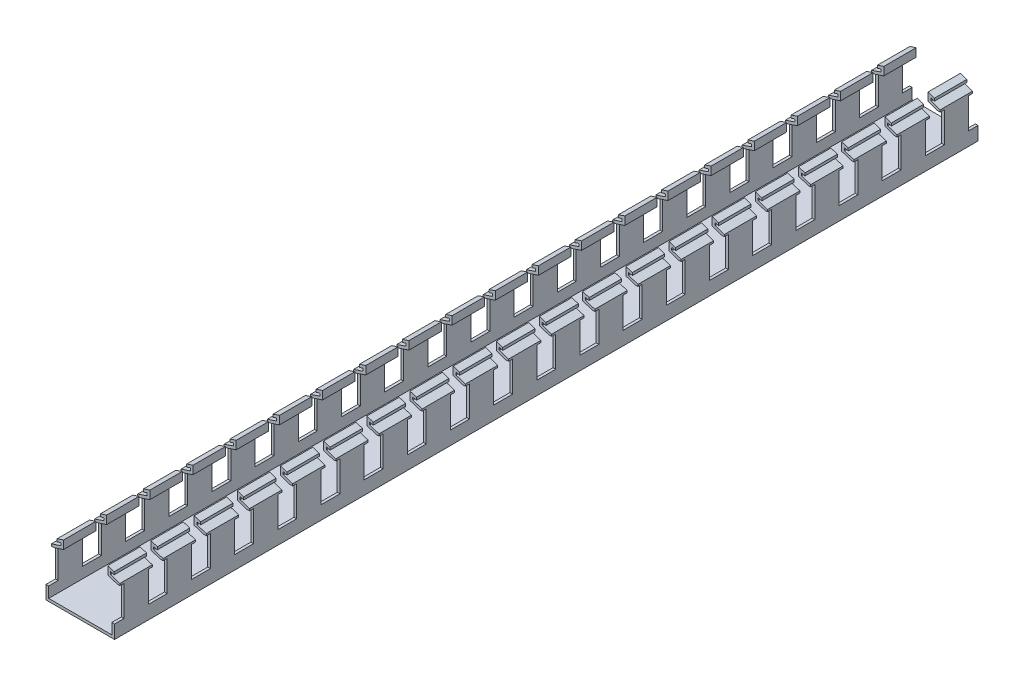
from build123d import *

# Parameters (mm, degrees)
SALIENTE_EXTRUIR1_DEPTH = 8
CORTAR_EXTRUIR1_DEPTH   = 33
MATRIZL1_COUNT          = 20
MATRIZL1_PITCH          = 16


with BuildPart() as part:
    # Croquis2 → Saliente-Extruir1 (new, symmetric)
    with BuildSketch(Plane.XY):
        with BuildLine():
            Line((-12.7, 0), (12.7, 0))
            Line((12.7, 0), (12.7, 17))
            Line((12.7, 17), (9.336754447, 18.121081851))
            ThreePointArc((9.336754447, 18.121081851), (9.237751563, 18.193876454), (9.2, 18.310818511))
            Line((9.2, 18.310818511), (9.2, 18.889181489))
            ThreePointArc((9.2, 18.889181489), (9.283057943, 19.051429926), (9.463245553, 19.078918149))
            Line((9.463245553, 19.078918149), (10.571708245, 18.709430585))
            Line((10.571708245, 18.709430585), (10.571708245, 19.709430585))
            Line((10.571708245, 19.709430585), (8.2, 20.5))
            Line((8.2, 20.5), (8.2, 17.445907447))
            Line((8.2, 17.445907447), (11.7, 16.27924078))
            Line((11.7, 16.27924078), (11.7, 1))
            Line((11.7, 1), (-11.7, 1))
            Line((-11.7, 1), (-11.7, 16.27924078))
            Line((-11.7, 16.27924078), (-8.2, 17.445907447))
            Line((-8.2, 17.445907447), (-8.2, 20.5))
            Line((-8.2, 20.5), (-10.571708245, 19.709430585))
            Line((-10.571708245, 19.709430585), (-10.571708245, 18.709430585))
            Line((-10.571708245, 18.709430585), (-9.463245553, 19.078918149))
            ThreePointArc((-9.463245553, 19.078918149), (-9.283057943, 19.051429926), (-9.2, 18.889181489))
            Line((-9.2, 18.889181489), (-9.2, 18.310818511))
            ThreePointArc((-9.2, 18.310818511), (-9.237751563, 18.193876454), (-9.336754447, 18.121081851))
            Line((-9.336754447, 18.121081851), (-12.7, 17))
            Line((-12.7, 17), (-12.7, 0))
        make_face()
    saliente_extruir1 = extrude(amount=SALIENTE_EXTRUIR1_DEPTH, both=True)

    # Croquis3 → Cortar-Extruir1 (cut, symmetric)
    with BuildSketch(Plane(origin=(0, 0, 0), x_dir=(0, 0, -1), z_dir=(1, 0, 0))):
        Polygon((-8, 5), (-4.5, 5), (-4.5, 16.27924078), (-6, 16.27924078), (-6, 20.5), (-8, 20.5), align=None)
        Polygon((8, 20.5), (6, 20.5), (6, 16.27924078), (4.5, 16.27924078), (4.5, 5), (8, 5), align=None)
    cortar_extruir1 = extrude(amount=CORTAR_EXTRUIR1_DEPTH, both=True, mode=Mode.SUBTRACT)

    # MatrizL1: Saliente-Extruir1, Cortar-Extruir1 ×20
    with Locations(*[(0, 0, -i * MATRIZL1_PITCH) for i in range(1, MATRIZL1_COUNT)]):
        add(saliente_extruir1)
        add(cortar_extruir1, mode=Mode.SUBTRACT)


solid = part.part
